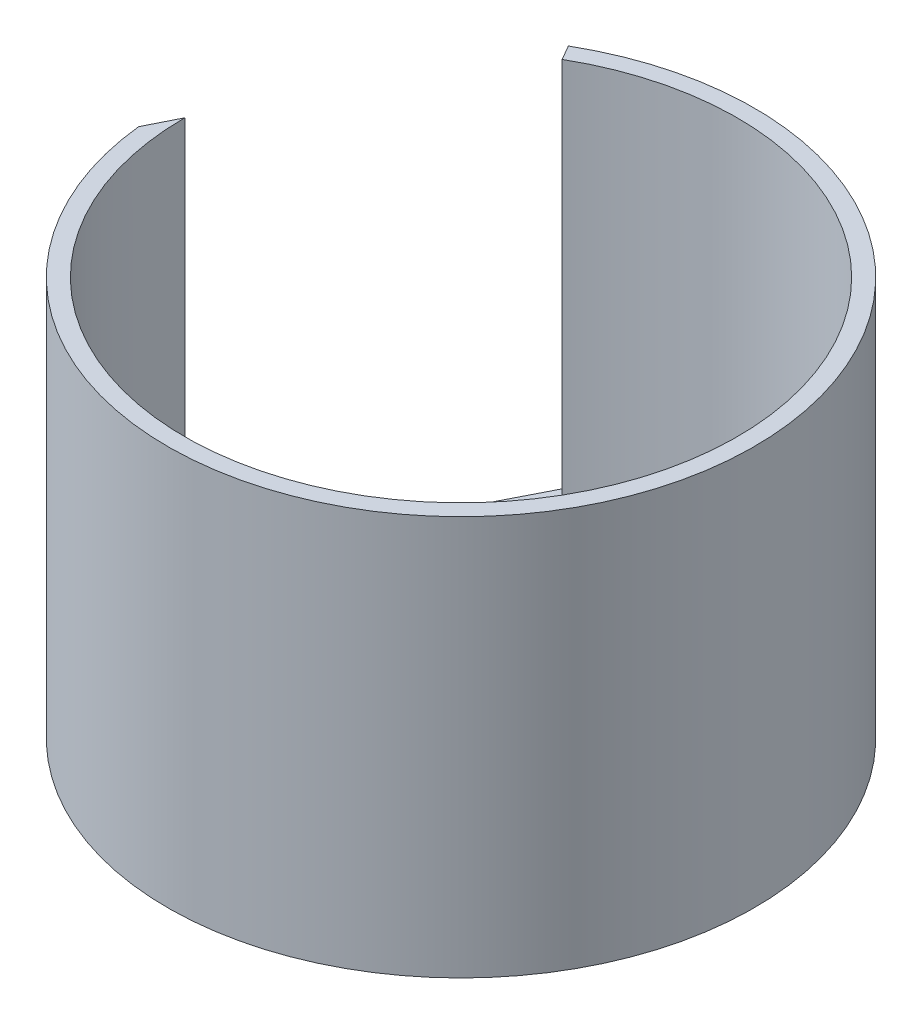
from build123d import *

# Parameters (mm, degrees)
SKETCH1_R           = 43.815
SKETCH1_R_2         = 41.275
EXTRUDE_THIN1_DEPTH = 57.15
CUT_EXTRUDE12_DEPTH = 85.29490465
CHAMFER1_SIZE       = 2.54
BOSS_EXTRUDE1_START = 2.54
BOSS_EXTRUDE1_DEPTH = 2.54


with BuildPart() as part:
    # Sketch1 → Extrude-Thin1 (new body)
    with BuildSketch(Plane(origin=(0, 0, 0), x_dir=(1, 0, 0), z_dir=(0, 1, 0))):
        Circle(SKETCH1_R)
        Circle(SKETCH1_R_2, mode=Mode.SUBTRACT)
    extrude(amount=EXTRUDE_THIN1_DEPTH)

    # Sketch4 → Cut-Extrude12 (cut, through all)
    with BuildSketch(Plane(origin=(0, 57.15, 0), x_dir=(1, 0, 0), z_dir=(0, 1, 0))):
        with BuildLine():
            Line((-41.275, 0), (-43.815, 0))
            ThreePointArc((-43.815, 0), (-37.944903067, 21.9075), (-21.9075, 37.944903067))
            Line((-21.9075, 37.944903067), (-20.6375, 35.745198541))
            ThreePointArc((-20.6375, 35.745198541), (-35.745198541, 20.6375), (-41.275, 0))
        make_face()
    extrude(amount=-CUT_EXTRUDE12_DEPTH, mode=Mode.SUBTRACT)

    # Chamfer1
    # the kernel refuses this chamfer: 5.08, 2.54 mm, written as the material it takes off along each edge
    with BuildSketch(Plane(origin=(-43.815, 69.10149318, 0), x_dir=(0.0525256370506935, 0, 0.998619575940918), z_dir=(0, -1, 0))) as chamfer1_piece_1:
        with BuildLine():
            Line((4.602821575, 0), (CHAMFER1_SIZE * 0.0525256370507, -CHAMFER1_SIZE * 0.998619575941))
            Line((CHAMFER1_SIZE * 0.0525256370507, -CHAMFER1_SIZE * 0.998619575941), (0, 0))
            ThreePointArc((0, 0), (2.389793213, 0.060394139), (4.602821575, 0))
        make_face()
    extrude(amount=81.05298636, mode=Mode.SUBTRACT)

    # Sketch5 → Boss-Extrude1 (add)
    with BuildSketch(Plane.XZ.offset(BOSS_EXTRUDE1_START)):
        with BuildLine():
            Line((-21.9075, -37.944903067), (-43.573233865, 4.596467729))
            ThreePointArc((-43.573233865, 4.596467729), (39.043228403, 19.884178154), (-21.9075, -37.944903067))
        make_face()
    extrude(amount=-BOSS_EXTRUDE1_DEPTH)


solid = part.part
